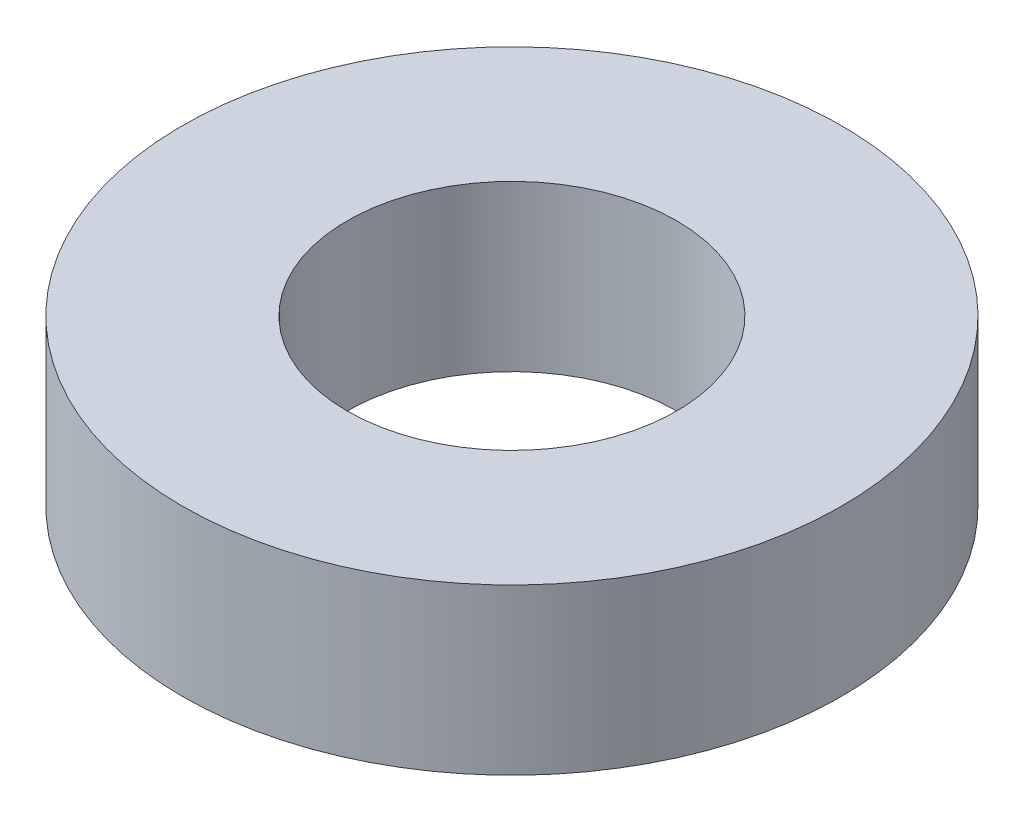
from build123d import *

# Parameters (mm, degrees)
SKETCH1_R           = 50
BOSS_EXTRUDE1_DEPTH = 25
SKETCH2_R           = 25
CUT_EXTRUDE1_DEPTH  = 76


with BuildPart() as part:
    # Sketch1 → Boss-Extrude1 (new body)
    with BuildSketch(Plane(origin=(0, 0, 0), x_dir=(1, 0, 0), z_dir=(0, 1, 0))):
        Circle(SKETCH1_R)
    extrude(amount=BOSS_EXTRUDE1_DEPTH)

    # Sketch2 → Cut-Extrude1 (cut, through all)
    with BuildSketch(Plane(origin=(0, 0, 0), x_dir=(1, 0, 0), z_dir=(0, 1, 0))):
        Circle(SKETCH2_R)
    extrude(amount=CUT_EXTRUDE1_DEPTH, mode=Mode.SUBTRACT)


solid = part.part
